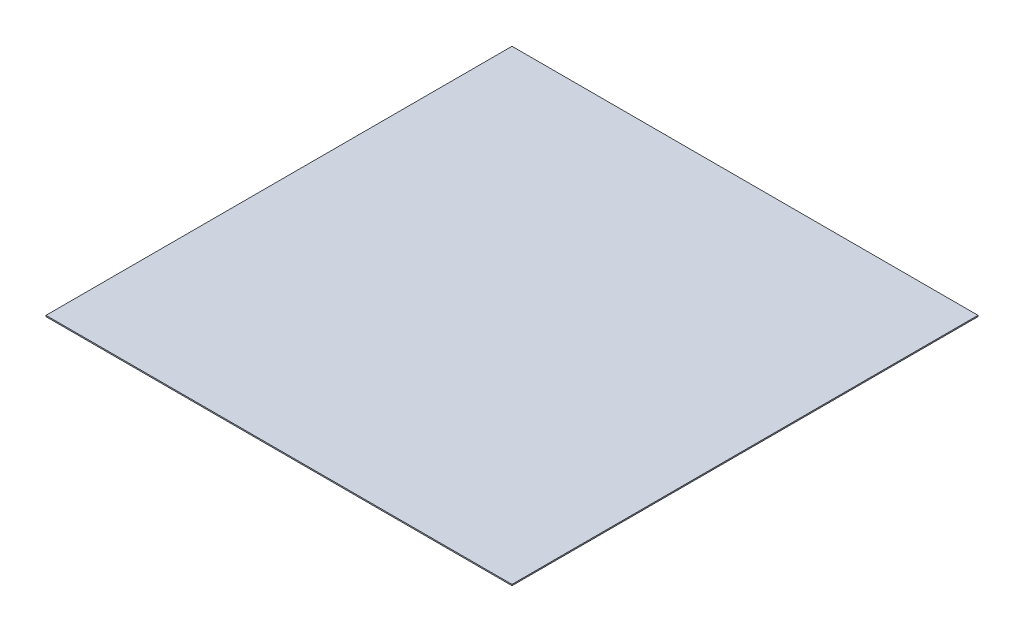
from build123d import *

# Parameters (mm, degrees)
SKETCH1_W           = 4927.6
SKETCH1_H           = 4927.6
BOSS_EXTRUDE1_DEPTH = 12.7


with BuildPart() as part:
    # Sketch1 → Boss-Extrude1 (new body)
    with BuildSketch(Plane(origin=(0, 0, 0), x_dir=(1, 0, 0), z_dir=(0, 1, 0))):
        Rectangle(SKETCH1_W, SKETCH1_H)
    extrude(amount=BOSS_EXTRUDE1_DEPTH)


solid = part.part
